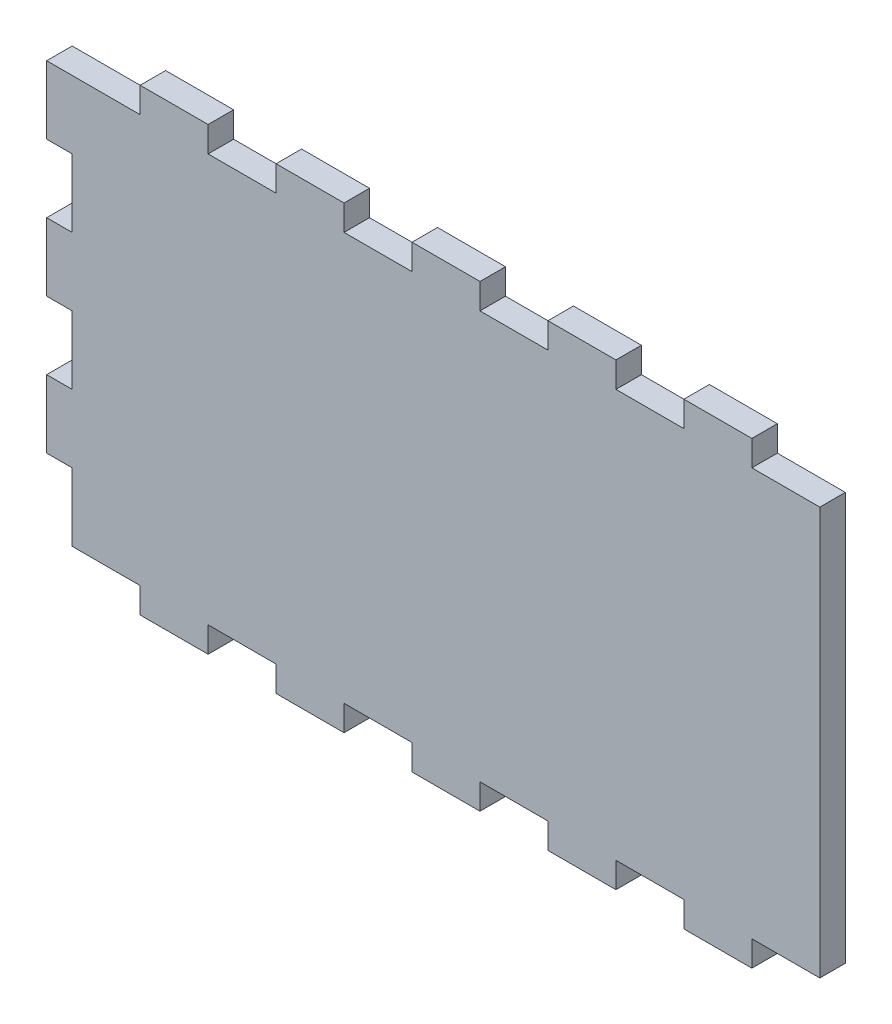
from build123d import *

# Parameters (mm, degrees)
SKETCH1_W               = 279.4
SKETCH1_H               = 152.4
BOSS_EXTRUDE1_DEPTH     = 9.525
SKETCH2_W               = 25.4
SKETCH2_H               = 9.525
BOSS_EXTRUDE2_DEPTH     = 9.525
LPATTERN1_COUNT         = 5
LPATTERN1_PITCH         = 50.8
MIRROR1_COPY_1_SKETCH_W = 25.4
MIRROR1_COPY_1_SKETCH_H = 9.525
MIRROR1_COPY_1_DEPTH    = 9.525
MIRROR1_COPY_2_SKETCH_W = 25.4
MIRROR1_COPY_2_SKETCH_H = 9.525
MIRROR1_COPY_2_DEPTH    = 9.525
MIRROR1_COPY_3_SKETCH_W = 25.4
MIRROR1_COPY_3_SKETCH_H = 9.525
MIRROR1_COPY_3_DEPTH    = 9.525
MIRROR1_COPY_4_SKETCH_W = 25.4
MIRROR1_COPY_4_SKETCH_H = 9.525
MIRROR1_COPY_4_DEPTH    = 9.525
MIRROR1_COPY_5_SKETCH_W = 25.4
MIRROR1_COPY_5_SKETCH_H = 9.525
MIRROR1_COPY_5_DEPTH    = 9.525
SKETCH3_W               = 9.525
SKETCH3_H               = 25.4
BOSS_EXTRUDE3_DEPTH     = 9.525
LPATTERN2_COUNT         = 3
LPATTERN2_PITCH         = 50.8


with BuildPart() as part:
    # Sketch1 → Boss-Extrude1 (new body)
    with BuildSketch(Plane.XY):
        Rectangle(SKETCH1_W, SKETCH1_H)
    extrude(amount=BOSS_EXTRUDE1_DEPTH)

    # Sketch2 → Boss-Extrude2 (add)
    with BuildSketch(Plane.XZ.offset(76.2)):
        with Locations((-101.6, 4.7625)):
            Rectangle(SKETCH2_W, SKETCH2_H)
    boss_extrude2 = extrude(amount=BOSS_EXTRUDE2_DEPTH)

    # LPattern1: Boss-Extrude2 ×5
    with Locations(*[(i * LPATTERN1_PITCH, 0, 0) for i in range(1, LPATTERN1_COUNT)]):
        add(boss_extrude2)

    # Mirror1 copy 1 sketch → Mirror1 copy 1 (add)
    with BuildSketch(Plane(origin=(50.8, 76.2, 0), x_dir=(1, 0, 0), z_dir=(0, 1, 0))):
        with Locations((-101.6, -4.7625)):
            Rectangle(MIRROR1_COPY_1_SKETCH_W, MIRROR1_COPY_1_SKETCH_H)
    extrude(amount=MIRROR1_COPY_1_DEPTH)

    # Mirror1 copy 2 sketch → Mirror1 copy 2 (add)
    with BuildSketch(Plane(origin=(101.6, 76.2, 0), x_dir=(1, 0, 0), z_dir=(0, 1, 0))):
        with Locations((-101.6, -4.7625)):
            Rectangle(MIRROR1_COPY_2_SKETCH_W, MIRROR1_COPY_2_SKETCH_H)
    extrude(amount=MIRROR1_COPY_2_DEPTH)

    # Mirror1 copy 3 sketch → Mirror1 copy 3 (add)
    with BuildSketch(Plane(origin=(152.4, 76.2, 0), x_dir=(1, 0, 0), z_dir=(0, 1, 0))):
        with Locations((-101.6, -4.7625)):
            Rectangle(MIRROR1_COPY_3_SKETCH_W, MIRROR1_COPY_3_SKETCH_H)
    extrude(amount=MIRROR1_COPY_3_DEPTH)

    # Mirror1 copy 4 sketch → Mirror1 copy 4 (add)
    with BuildSketch(Plane(origin=(203.2, 76.2, 0), x_dir=(1, 0, 0), z_dir=(0, 1, 0))):
        with Locations((-101.6, -4.7625)):
            Rectangle(MIRROR1_COPY_4_SKETCH_W, MIRROR1_COPY_4_SKETCH_H)
    extrude(amount=MIRROR1_COPY_4_DEPTH)

    # Mirror1 copy 5 sketch → Mirror1 copy 5 (add)
    with BuildSketch(Plane(origin=(0, 76.2, 0), x_dir=(1, 0, 0), z_dir=(0, 1, 0))):
        with Locations((-101.6, -4.7625)):
            Rectangle(MIRROR1_COPY_5_SKETCH_W, MIRROR1_COPY_5_SKETCH_H)
    extrude(amount=MIRROR1_COPY_5_DEPTH)

    # Sketch3 → Boss-Extrude3 (add)
    with BuildSketch(Plane.ZY.offset(139.7)):
        with Locations((4.7625, 63.5)):
            Rectangle(SKETCH3_W, SKETCH3_H)
    boss_extrude3 = extrude(amount=BOSS_EXTRUDE3_DEPTH)

    # LPattern2: Boss-Extrude3 ×3
    with Locations(*[(0, -i * LPATTERN2_PITCH, 0) for i in range(1, LPATTERN2_COUNT)]):
        add(boss_extrude3)


solid = part.part
